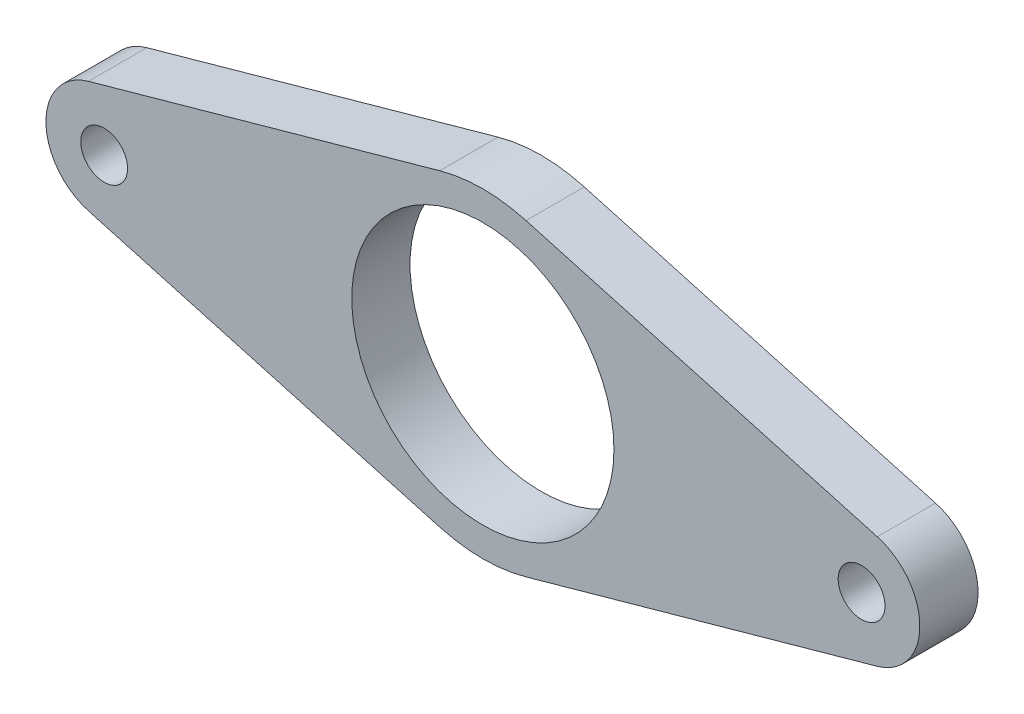
from build123d import *

# Parameters (mm, degrees)
SKETCH1_R           = 2.5527
SKETCH1_R_2         = 14.2875
BOSS_EXTRUDE1_DEPTH = 6.35


with BuildPart() as part:
    # Sketch1 → Boss-Extrude1 (new body)
    with BuildSketch(Plane.XY):
        with BuildLine():
            Line((-4.701442308, 16.817709311), (-42.984615385, 6.115530659))
            ThreePointArc((-42.984615385, 6.115530659), (-47.625, 0), (-42.984615385, -6.115530659))
            Line((-42.984615385, -6.115530659), (-4.701442308, -16.817709311))
            ThreePointArc((-4.701442308, -16.817709311), (0, -17.4625), (4.701442308, -16.817709311))
            Line((4.701442308, -16.817709311), (42.984615385, -6.115530659))
            ThreePointArc((42.984615385, -6.115530659), (47.625, 0), (42.984615385, 6.115530659))
            Line((42.984615385, 6.115530659), (4.701442308, 16.817709311))
            ThreePointArc((4.701442308, 16.817709311), (0, 17.4625), (-4.701442308, 16.817709311))
        make_face()
        with Locations((-41.275, 0)):
            Circle(SKETCH1_R, mode=Mode.SUBTRACT)
        Circle(SKETCH1_R_2, mode=Mode.SUBTRACT)
        with Locations((41.275, 0)):
            Circle(SKETCH1_R, mode=Mode.SUBTRACT)
    extrude(amount=BOSS_EXTRUDE1_DEPTH)


solid = part.part
